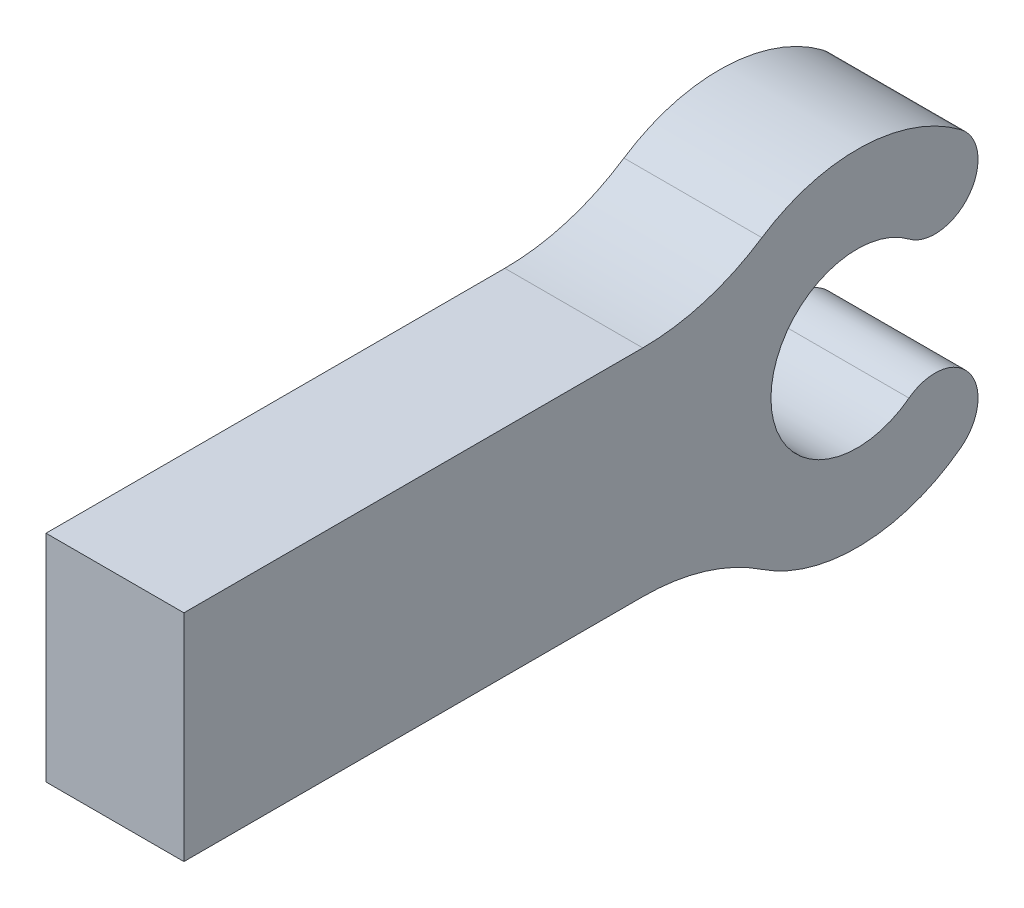
from build123d import *

# Parameters (mm, degrees)
BOSS_EXTRUDE1_DEPTH = 1.6256
FILLET1_R           = 2.54


with BuildPart() as part:
    # Sketch1 → Boss-Extrude1 (new body)
    with BuildSketch(Plane(origin=(0, 0, 0), x_dir=(0, 0, -1), z_dir=(1, 0, 0))):
        with BuildLine():
            Line((0, 0), (6.35, 0))
            ThreePointArc((6.35, 0), (7.682998327, -0.746159214), (9.159117619, -0.352827356))
            ThreePointArc((9.159117619, -0.352827356), (9.259102426, 0.358601514), (8.547673555, 0.458586322))
            ThreePointArc((8.547673555, 0.458586322), (6.920229492, 1.27), (8.547673555, 2.081413678))
            ThreePointArc((8.547673555, 2.081413678), (9.259102426, 2.181398486), (9.159117619, 2.892827356))
            ThreePointArc((9.159117619, 2.892827356), (7.682998327, 3.286159214), (6.35, 2.54))
            Line((6.35, 2.54), (0, 2.54))
            Line((0, 2.54), (0, 0))
        make_face()
    extrude(amount=BOSS_EXTRUDE1_DEPTH)

    # Fillet1
    fillet1_edges = [part.edges().sort_by_distance(p)[0] for p in [
        (0.8128, 0, -6.35),
        (0.8128, 2.54, -6.35),
    ]]
    fillet(fillet1_edges, radius=FILLET1_R)


solid = part.part
